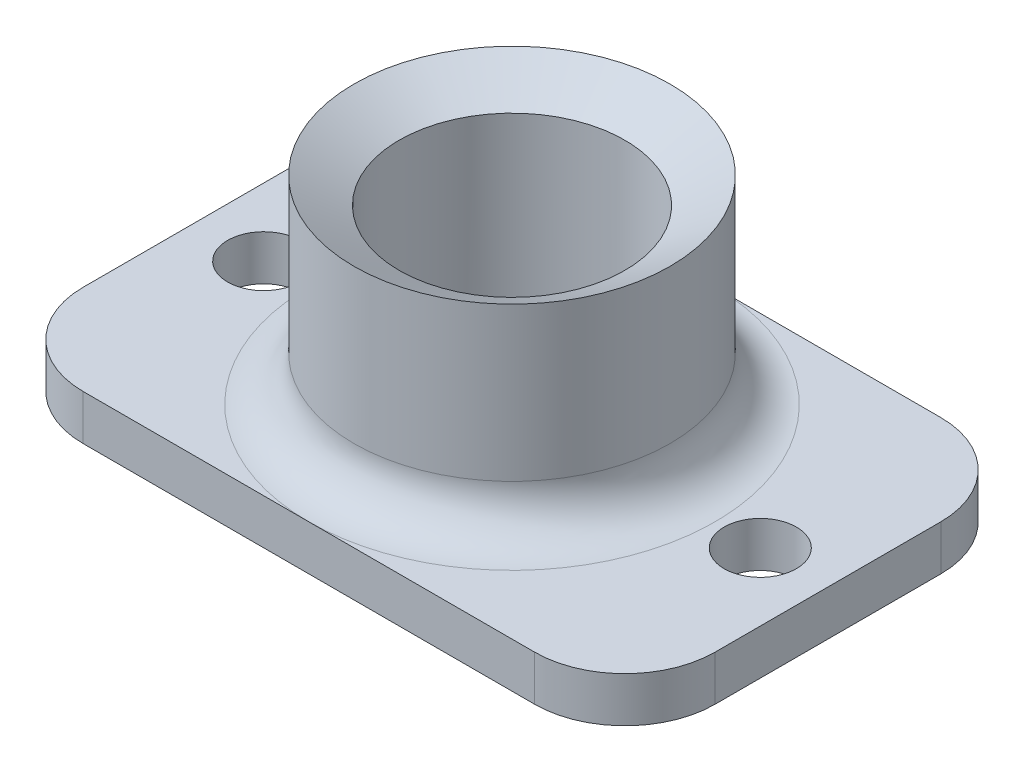
from build123d import *

# Parameters (mm, degrees)
CROQUIS1_W              = 70
CROQUIS1_H              = 45
SALIENTE_EXTRUIR1_DEPTH = 5
REDONDEO1_R             = 10
REDONDEO2_R             = 10
CROQUIS2_R              = 17.5
SALIENTE_EXTRUIR2_DEPTH = 22
REDONDEO3_R             = 5
CROQUIS3_R              = 12.5
CORTAR_EXTRUIR1_DEPTH   = 50.60090725
CHAFL_N1_SIZE2          = 2.886751346
CHAFL_N1_SIZE           = 5
CROQUIS4_R              = 14.6
CORTAR_EXTRUIR2_DEPTH   = 2
CROQUIS5_R              = 4
CORTAR_EXTRUIR3_DEPTH   = 48.066442398


with BuildPart() as part:
    # Croquis1 → Saliente-Extruir1 (new body)
    with BuildSketch(Plane(origin=(0, 0, 0), x_dir=(1, 0, 0), z_dir=(0, 1, 0))):
        Rectangle(CROQUIS1_W, CROQUIS1_H)
    extrude(amount=SALIENTE_EXTRUIR1_DEPTH)

    # Redondeo1
    redondeo1_edges = [part.edges().sort_by_distance(p)[0] for p in [
        (35, 2.5, 22.5),
    ]]
    fillet(redondeo1_edges, radius=REDONDEO1_R)

    # Redondeo2
    redondeo2_edges = [part.edges().sort_by_distance(p)[0] for p in [
        (-35, 2.5, 22.5),
        (-35, 2.5, -22.5),
        (35, 2.5, -22.5),
    ]]
    fillet(redondeo2_edges, radius=REDONDEO2_R)

    # Croquis2 → Saliente-Extruir2 (add)
    with BuildSketch(Plane(origin=(0, 5, 0), x_dir=(1, 0, 0), z_dir=(0, 1, 0))):
        with Locations(Location((0, 0, 0), (0, 0, 270))):
            Circle(CROQUIS2_R)
    extrude(amount=SALIENTE_EXTRUIR2_DEPTH)

    # Redondeo3
    redondeo3_edges = [part.edges().sort_by_distance(p)[0] for p in [
        (0, 5, -17.5),
    ]]
    fillet(redondeo3_edges, radius=REDONDEO3_R - 0.0001)  # a hair under: the kernel refuses the full size

    # Croquis3 → Cortar-Extruir1 (cut, through all)
    with BuildSketch(Plane(origin=(0, 27, 0), x_dir=(1, 0, 0), z_dir=(0, 1, 0))):
        with Locations(Location((0, 0, 0), (0, 0, 270))):
            Circle(CROQUIS3_R)
    extrude(amount=-CORTAR_EXTRUIR1_DEPTH, mode=Mode.SUBTRACT)

    # Chaflán1
    chafl_n1_edges = [part.edges().sort_by_distance(p)[0] for p in [
        (0, 27, -12.5),
    ]]
    chafl_n1_side = [part.faces().sort_by_distance(p)[0] for p in [
        (0, 27, -12.557735027),
    ]]
    chamfer(chafl_n1_edges, length=CHAFL_N1_SIZE - 0.0001, length2=CHAFL_N1_SIZE2 - 0.0001, reference=chafl_n1_side[0])  # a hair under: the kernel refuses the full size

    # Croquis4 → Cortar-Extruir2 (cut)
    with BuildSketch(Plane(origin=(0, 0, 0), x_dir=(-1, 0, 0), z_dir=(0, -1, 0))):
        with Locations(Location((0, 0, 0), (0, 0, 90))):
            Circle(CROQUIS4_R)
    extrude(amount=-CORTAR_EXTRUIR2_DEPTH, mode=Mode.SUBTRACT)

    # Croquis5 → Cortar-Extruir3 (cut, through all)
    with BuildSketch(Plane(origin=(0, 5, 0), x_dir=(1, 0, 0), z_dir=(0, 1, 0))):
        with Locations(Location((-27.5, 0, 0), (0, 0, 270))):
            Circle(CROQUIS5_R)
        with Locations(Location((27.5, 0, 0), (0, 0, 270))):
            Circle(CROQUIS5_R)
    extrude(amount=-CORTAR_EXTRUIR3_DEPTH, mode=Mode.SUBTRACT)


solid = part.part
